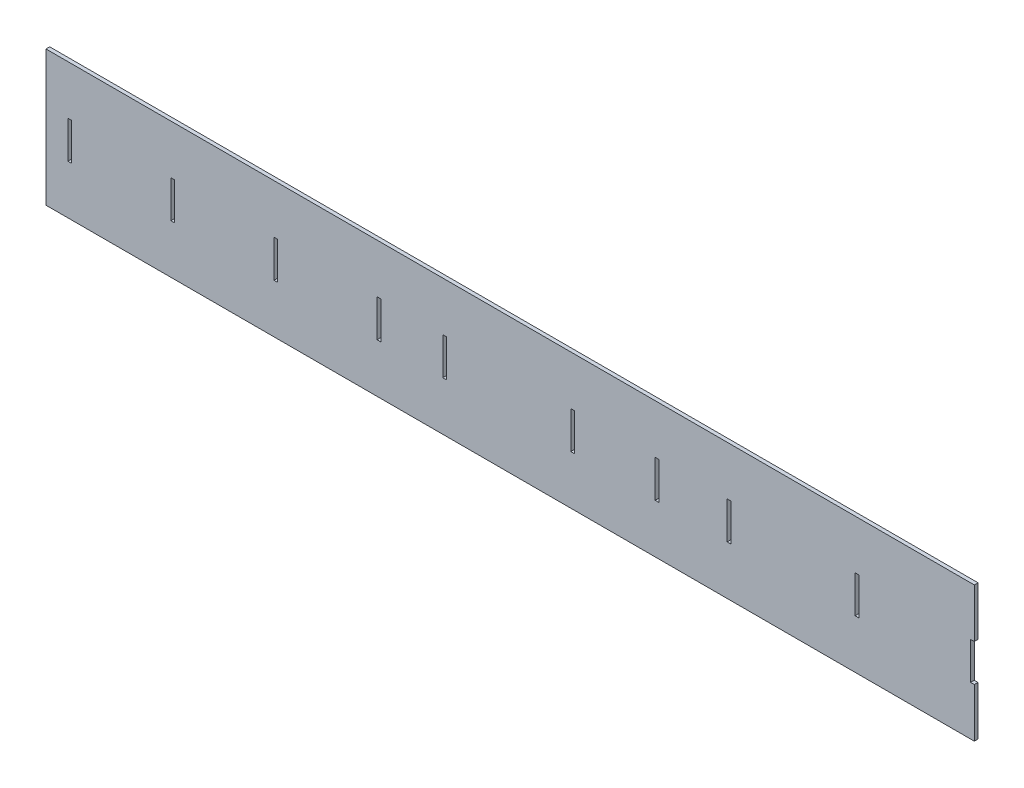
from build123d import *

# Parameters (mm, degrees)
SKETCH1_W           = 3
SKETCH1_H           = 30
BOSS_EXTRUDE1_DEPTH = 3


with BuildPart() as part:
    # Sketch1 → Boss-Extrude1 (new body)
    with BuildSketch(Plane.XY):
        Polygon((110.35106383, 109), (858, 109), (858, 69.5), (855, 69.5), (855, 39.5), (858, 39.5), (858, 0), (110.35106383, 0), align=None)
        with Locations((129.5, 54.5)):
            Rectangle(SKETCH1_W, SKETCH1_H, mode=Mode.SUBTRACT)
        with Locations((212.5, 54.5)):
            Rectangle(SKETCH1_W, SKETCH1_H, mode=Mode.SUBTRACT)
        with Locations((295.5, 54.5)):
            Rectangle(SKETCH1_W, SKETCH1_H, mode=Mode.SUBTRACT)
        with Locations((378.5, 54.5)):
            Rectangle(SKETCH1_W, SKETCH1_H, mode=Mode.SUBTRACT)
        with Locations((431.5, 54.5)):
            Rectangle(SKETCH1_W, SKETCH1_H, mode=Mode.SUBTRACT)
        with Locations((534.5, 54.5)):
            Rectangle(SKETCH1_W, SKETCH1_H, mode=Mode.SUBTRACT)
        with Locations((602.5, 54.5)):
            Rectangle(SKETCH1_W, SKETCH1_H, mode=Mode.SUBTRACT)
        with Locations((660.5, 54.5)):
            Rectangle(SKETCH1_W, SKETCH1_H, mode=Mode.SUBTRACT)
        with Locations((763.5, 54.5)):
            Rectangle(SKETCH1_W, SKETCH1_H, mode=Mode.SUBTRACT)
    extrude(amount=BOSS_EXTRUDE1_DEPTH)


solid = part.part
